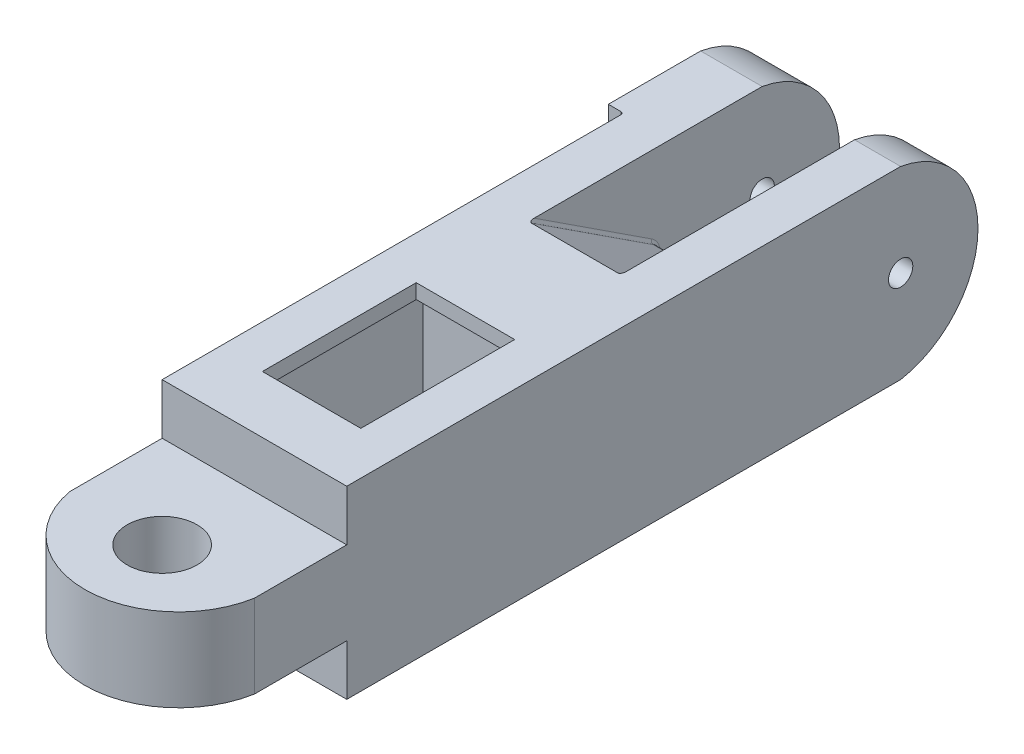
from build123d import *

# Parameters (mm, degrees)
SKETCH2_W               = 60
SKETCH2_H               = 60
BOSS_EXTRUDE1_DEPTH     = 150
SKETCH3_W               = 15
SKETCH3_H               = 60
BOSS_EXTRUDE2_DEPTH     = 30
BOSS_EXTRUDE3_DEPTH     = 15
BOSS_EXTRUDE4_START     = -15
BOSS_EXTRUDE4_DEPTH     = 15
SKETCH6_W               = 60
SKETCH6_H               = 27
BOSS_EXTRUDE5_DEPTH     = 30
BOSS_EXTRUDE6_DEPTH     = 27
CUT_EXTRUDE2_DEPTH      = 5
CUT_EXTRUDE2_DEPTH_BACK = 70
CUT_EXTRUDE2_START      = -10
SKETCH8_W               = 50.5
SKETCH8_H               = 50.5
SKETCH9_R               = 11.35
CUT_EXTRUDE3_DEPTH      = 130
SKETCH11_R              = 3.95
CUT_EXTRUDE4_DEPTH      = 213.148433405
SKETCH12_R              = 3.95
CUT_EXTRUDE5_DEPTH      = 213.148433405
BOSS_EXTRUDE7_DEPTH     = 5
SKETCH14_R              = 4.15
CUT_EXTRUDE6_DEPTH      = 10
FILLET2_R               = 1
CUT_EXTRUDE8_DEPTH      = 30
FILLET7_R               = 5
FILLET8_R               = 1
FILLET9_R               = 1
SKETCH22_W              = 32
SKETCH22_H              = 50
CUT_EXTRUDE9_DEPTH      = 68


with BuildPart() as part:
    # Sketch2 → Boss-Extrude1 (new body)
    with BuildSketch(Plane.XY):
        Rectangle(SKETCH2_W, SKETCH2_H)
    extrude(amount=BOSS_EXTRUDE1_DEPTH)

    # Sketch3 → Boss-Extrude2 (add)
    with BuildSketch(Plane(origin=(0, 0, 0), x_dir=(-1, 0, 0), z_dir=(0, 0, -1))):
        with Locations((22.5, 0)):
            Rectangle(SKETCH3_W, SKETCH3_H)
        with Locations((-22.5, 0)):
            Rectangle(SKETCH3_W, SKETCH3_H)
    extrude(amount=BOSS_EXTRUDE2_DEPTH)

    # Sketch4 → Boss-Extrude3 (add)
    with BuildSketch(Plane(origin=(30, 0, 0), x_dir=(0, 0, -1), z_dir=(1, 0, 0))):
        with BuildLine():
            Line((30, 30), (30, -30))
            ThreePointArc((30, -30), (55.138874415, 0), (30, 30))
        make_face()
    extrude(amount=-BOSS_EXTRUDE3_DEPTH)

    # Sketch5 → Boss-Extrude4 (add)
    with BuildSketch(Plane.ZY.offset(30).offset(BOSS_EXTRUDE4_START)):
        with BuildLine():
            Line((-30, -30), (-30, 30))
            ThreePointArc((-30, 30), (-55.138874415, 0), (-30, -30))
        make_face()
    extrude(amount=BOSS_EXTRUDE4_DEPTH)

    # Sketch6 → Boss-Extrude5 (add)
    with BuildSketch(Plane.XY.offset(150)):
        Rectangle(SKETCH6_W, SKETCH6_H)
    extrude(amount=BOSS_EXTRUDE5_DEPTH)

    # Sketch7 → Boss-Extrude6 (add)
    with BuildSketch(Plane(origin=(0, 13.5, 0), x_dir=(1, 0, 0), z_dir=(0, 1, 0))):
        with BuildLine():
            Line((30, -180), (-30, -180))
            ThreePointArc((-30, -180), (0, -205.138874415), (30, -180))
        make_face()
    extrude(amount=-BOSS_EXTRUDE6_DEPTH)

    # Sketch8 → Cut-Extrude2 (cut, two sides: drawn at the far end of the back side and taken through both)
    with BuildSketch(Plane.XY.offset(150).offset(CUT_EXTRUDE2_START - CUT_EXTRUDE2_DEPTH_BACK)):
        Rectangle(SKETCH8_W, SKETCH8_H)
    extrude(amount=CUT_EXTRUDE2_DEPTH + CUT_EXTRUDE2_DEPTH_BACK, mode=Mode.SUBTRACT)

    # Sketch9 → Cut-Extrude3 (cut)
    with BuildSketch(Plane(origin=(0, -13.5, 0), x_dir=(-1, 0, 0), z_dir=(0, -1, 0))):
        with Locations((0, -180)):
            Circle(SKETCH9_R)
    extrude(amount=-CUT_EXTRUDE3_DEPTH, mode=Mode.SUBTRACT)

    # Sketch11 → Cut-Extrude4 (cut, through all)
    with BuildSketch(Plane.ZY.offset(-15)):
        with Locations((-30, 0)):
            Circle(SKETCH11_R)
    extrude(amount=-CUT_EXTRUDE4_DEPTH, mode=Mode.SUBTRACT)

    # Sketch12 → Cut-Extrude5 (cut, through all)
    with BuildSketch(Plane(origin=(-15, 0, 0), x_dir=(0, 0, -1), z_dir=(1, 0, 0))):
        with Locations((30, 0)):
            Circle(SKETCH12_R)
    extrude(amount=-CUT_EXTRUDE5_DEPTH, mode=Mode.SUBTRACT)

    # Sketch13 → Boss-Extrude7 (add)
    with BuildSketch(Plane.ZY.offset(30)):
        with BuildLine():
            Line((-30, 30), (0, 30))
            Line((0, 30), (0, -30))
            Line((0, -30), (-30, -30))
            ThreePointArc((-30, -30), (-55.138874415, 0), (-30, 30))
        make_face()
    extrude(amount=BOSS_EXTRUDE7_DEPTH)

    # Sketch14 → Cut-Extrude6 (cut)
    with BuildSketch(Plane.ZY.offset(35)):
        with Locations((-30, 0)):
            Circle(SKETCH14_R)
    extrude(amount=-CUT_EXTRUDE6_DEPTH, mode=Mode.SUBTRACT)

    # Fillet2
    fillet2_edges = [part.edges().sort_by_distance(p)[0] for p in [
        (-30, 0, 0),
    ]]
    fillet(fillet2_edges, radius=FILLET2_R)

    # Sketch19 → Cut-Extrude8 (cut)
    with BuildSketch(Plane.ZY.offset(-15)):
        Polygon((0, 0), (0, -30), (45.937030861, -30), align=None)
        Polygon((0, 30), (0, 0), (45.937030861, 30), align=None)
    extrude(amount=CUT_EXTRUDE8_DEPTH, mode=Mode.SUBTRACT)

    # Fillet7
    fillet7_edges = [part.edges().sort_by_distance(p)[0] for p in [
        (0, 0, 0),
    ]]
    fillet(fillet7_edges, radius=FILLET7_R)

    # Fillet8
    fillet8_edges = [part.edges().sort_by_distance(p)[0] for p in [
        (15, -17.09316987, 26.173649061),
        (15, 0, 4.144231339),
        (15, 17.09316987, 26.173649061),
    ]]
    fillet(fillet8_edges, radius=FILLET8_R)

    # Fillet9
    fillet9_edges = [part.edges().sort_by_distance(p)[0] for p in [
        (-15, -17.09316987, 26.173649061),
        (-15, 0, 4.144231339),
        (-15, 17.09316987, 26.173649061),
    ]]
    fillet(fillet9_edges, radius=FILLET9_R)

    # Sketch22 → Cut-Extrude9 (cut)
    with BuildSketch(Plane.XZ.offset(30)):
        with Locations((0, 106.429335095)):
            Rectangle(SKETCH22_W, SKETCH22_H)
    extrude(amount=-CUT_EXTRUDE9_DEPTH, mode=Mode.SUBTRACT)


solid = part.part
